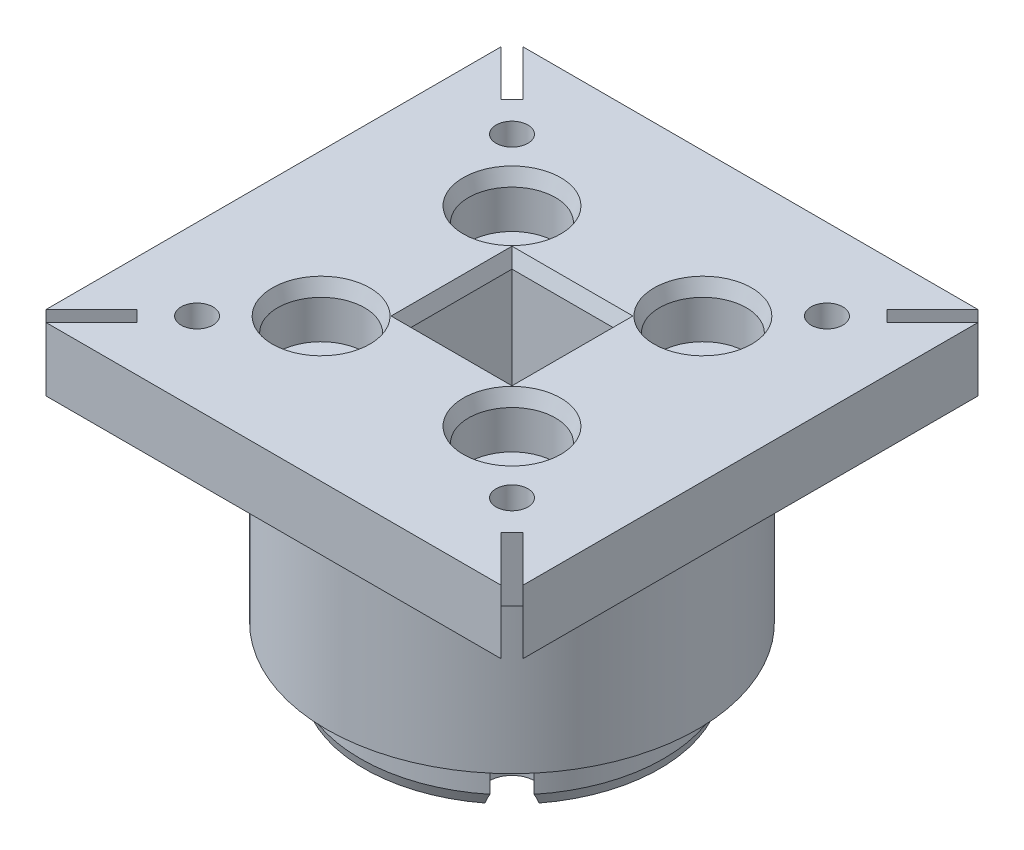
from build123d import *

# Parameters (mm, degrees)
SKETCH1_R           = 17.5
BOSS_EXTRUDE1_DEPTH = 25
SKETCH3_R           = 14.3
BOSS_EXTRUDE2_DEPTH = 5
SKETCH4_W           = 10.4
SKETCH4_H           = 10.4
CUT_EXTRUDE1_DEPTH  = 39.890872965
SKETCH6_R           = 2.1
CUT_EXTRUDE2_DEPTH  = 39.890872965
CHAMFER1_SIZE       = 0.363970234
CHAMFER1_SIZE_2     = 1
SKETCH7_R           = 4.1
CUT_EXTRUDE3_DEPTH  = 5
CHAMFER2_SIZE       = 0.5
CHAMFER2_SIZE2      = 1.37373871
BOSS_EXTRUDE3_START = -6
SKETCH8_W           = 45
SKETCH8_H           = 45
SKETCH8_R           = 17.5
SKETCH8_R_2         = 1.5
BOSS_EXTRUDE3_DEPTH = 6
CUT_EXTRUDE4_DEPTH  = 44.73213928
CHAMFER3_SIZE       = 0.5
CHAMFER3_SIZE2      = 1.37373871


with BuildPart() as part:
    # Sketch1 → Boss-Extrude1 (new body)
    with BuildSketch(Plane(origin=(0, 0, 0), x_dir=(1, 0, 0), z_dir=(0, 1, 0))):
        with Locations(Location((0, 0, 0), (0, 0, 270))):
            Circle(SKETCH1_R)
    extrude(amount=BOSS_EXTRUDE1_DEPTH)

    # Sketch3 → Boss-Extrude2 (add)
    with BuildSketch(Plane.XZ):
        with Locations(Location((0, 0, 0), (0, 0, 90))):
            Circle(SKETCH3_R)
    extrude(amount=BOSS_EXTRUDE2_DEPTH)

    # Sketch4 → Cut-Extrude1 (cut, through all)
    with BuildSketch(Plane(origin=(0, 25, 0), x_dir=(1, 0, 0), z_dir=(0, 1, 0))):
        Rectangle(SKETCH4_W, SKETCH4_H)
    extrude(amount=-CUT_EXTRUDE1_DEPTH, mode=Mode.SUBTRACT)

    # Sketch6 → Cut-Extrude2 (cut, through all)
    with BuildSketch(Plane(origin=(0, 25, 0), x_dir=(1, 0, 0), z_dir=(0, 1, 0))):
        with Locations(Location((9, -9, 0), (0, 0, 270))):
            Circle(SKETCH6_R)
        with Locations(Location((-9, -9, 0), (0, 0, 270))):
            Circle(SKETCH6_R)
        with Locations(Location((-9, 9, 0), (0, 0, 270))):
            Circle(SKETCH6_R)
        with Locations(Location((9, 9, 0), (0, 0, 270))):
            Circle(SKETCH6_R)
    extrude(amount=-CUT_EXTRUDE2_DEPTH, mode=Mode.SUBTRACT)

    # Chamfer1
    # the kernel refuses this chamfer: 1, 0.363970234 mm, written as the material it takes off along each edge
    with BuildSketch(Plane(origin=(0, -5, 0), x_dir=(-0.7601968687413804, 0, 0.649692789521171), z_dir=(-0.649692789521171, 0, -0.7601968687413804))) as chamfer1_piece_1:
        Polygon((14.3 - CHAMFER1_SIZE, 0), (14.3, CHAMFER1_SIZE_2), (14.3, 0), align=None)
    revolve(axis=Axis((0, -5, 0), (0, 1, 0)), revolution_arc=98.963112953, mode=Mode.SUBTRACT)
    with BuildSketch(Plane(origin=(0, -5, 0), x_dir=(-0.6496927895211715, 0, 0.7601968687413799), z_dir=(0.7601968687413799, 0, 0.6496927895211715))) as chamfer1_piece_2:
        Polygon((14.3 - CHAMFER1_SIZE, 0), (14.3, -CHAMFER1_SIZE_2), (14.3, 0), align=None)
    revolve(axis=Axis((0, -5, 0), (0, -1, 0)), revolution_arc=98.963112953, mode=Mode.SUBTRACT)
    with BuildSketch(Plane(origin=(0, -5, 0), x_dir=(-0.7601968687413795, 0, -0.6496927895211719), z_dir=(-0.6496927895211719, 0, 0.7601968687413795))) as chamfer1_piece_3:
        Polygon((14.3, -CHAMFER1_SIZE_2), (14.3 - CHAMFER1_SIZE, 0), (14.3, 0), align=None)
    revolve(axis=Axis((0, -5, 0), (0, -1, 0)), revolution_arc=98.963112953, mode=Mode.SUBTRACT)
    with BuildSketch(Plane(origin=(0, -5, 0), x_dir=(0.6496927895211716, 0, -0.7601968687413798), z_dir=(-0.7601968687413798, 0, -0.6496927895211716))) as chamfer1_piece_4:
        Polygon((14.3, -CHAMFER1_SIZE_2), (14.3 - CHAMFER1_SIZE, 0), (14.3, 0), align=None)
    revolve(axis=Axis((0, -5, 0), (0, -1, 0)), revolution_arc=98.963112953, mode=Mode.SUBTRACT)

    # Sketch7 → Cut-Extrude3 (cut)
    with BuildSketch(Plane(origin=(0, 25, 0), x_dir=(1, 0, 0), z_dir=(0, 1, 0))):
        with Locations(Location((9, 9, 0), (0, 0, 270))):
            Circle(SKETCH7_R)
        with Locations(Location((-9, 9, 0), (0, 0, 270))):
            Circle(SKETCH7_R)
        with Locations(Location((-9, -9, 0), (0, 0, 270))):
            Circle(SKETCH7_R)
        with Locations(Location((9, -9, 0), (0, 0, 270))):
            Circle(SKETCH7_R)
    extrude(amount=-CUT_EXTRUDE3_DEPTH, mode=Mode.SUBTRACT)

    # Chamfer2
    chamfer2_edges = [part.edges().sort_by_distance(p)[0] for p in [
        (5.2, 25, 0),
        (0, 25, -5.2),
        (-5.2, 25, 0),
        (0, 25, 5.2),
    ]]
    chamfer2_side = [part.faces().sort_by_distance(p)[0] for p in [
        (0, 25, -17.005025253),
    ]]
    chamfer(chamfer2_edges, length=CHAMFER2_SIZE, length2=CHAMFER2_SIZE2, reference=chamfer2_side[0])

    # Sketch8 → Boss-Extrude3 (add)
    with BuildSketch(Plane(origin=(0, 25, 0), x_dir=(1, 0, 0), z_dir=(0, 1, 0)).offset(BOSS_EXTRUDE3_START)):
        Rectangle(SKETCH8_W, SKETCH8_H)
        with Locations(Location((0, 0, 0), (0, 0, 270))):
            Circle(SKETCH8_R, mode=Mode.SUBTRACT)
        with Locations(Location((-14.849242405, -14.849242405, 0), (0, 0, 270))):
            Circle(SKETCH8_R_2, mode=Mode.SUBTRACT)
        with Locations(Location((-14.849242405, 14.849242405, 0), (0, 0, 270))):
            Circle(SKETCH8_R_2, mode=Mode.SUBTRACT)
        with Locations(Location((14.849242405, 14.849242405, 0), (0, 0, 270))):
            Circle(SKETCH8_R_2, mode=Mode.SUBTRACT)
        with Locations(Location((14.849242405, -14.849242405, 0), (0, 0, 270))):
            Circle(SKETCH8_R_2, mode=Mode.SUBTRACT)
    extrude(amount=BOSS_EXTRUDE3_DEPTH)

    # Sketch10 → Cut-Extrude4 (cut, through all)
    with BuildSketch(Plane(origin=(0, 25, 0), x_dir=(1, 0, 0), z_dir=(0, 1, 0))):
        Polygon((-18.207999616, -17.147339444), (-17.147339444, -18.207999616), (-21.439339828, -22.5), (-22.5, -22.5), (-22.5, -21.439339828), align=None)
        Polygon((-22.5, 21.439339828), (-18.207999616, 17.147339444), (-17.147339444, 18.207999616), (-21.439339828, 22.5), (-22.5, 22.5), align=None)
        Polygon((21.439339828, 22.5), (17.147339444, 18.207999616), (18.207999616, 17.147339444), (22.5, 21.439339828), (22.5, 22.5), align=None)
        Polygon((17.147339444, -18.207999616), (18.207999616, -17.147339444), (22.5, -21.439339828), (22.5, -22.5), (21.439339828, -22.5), align=None)
    extrude(amount=-CUT_EXTRUDE4_DEPTH, mode=Mode.SUBTRACT)

    # Chamfer3
    chamfer3_edges = [part.edges().sort_by_distance(p)[0] for p in [
        (-9, 25, -13.1),
        (-9, 25, 4.9),
        (9, 25, 4.9),
        (9, 25, -13.1),
    ]]
    chamfer3_side = [part.faces().sort_by_distance(p)[0] for p in [
        (18.843339636, 25, -20.803999808),
    ]]
    chamfer(chamfer3_edges, length=CHAMFER3_SIZE, length2=CHAMFER3_SIZE2, reference=chamfer3_side[0])


solid = part.part
